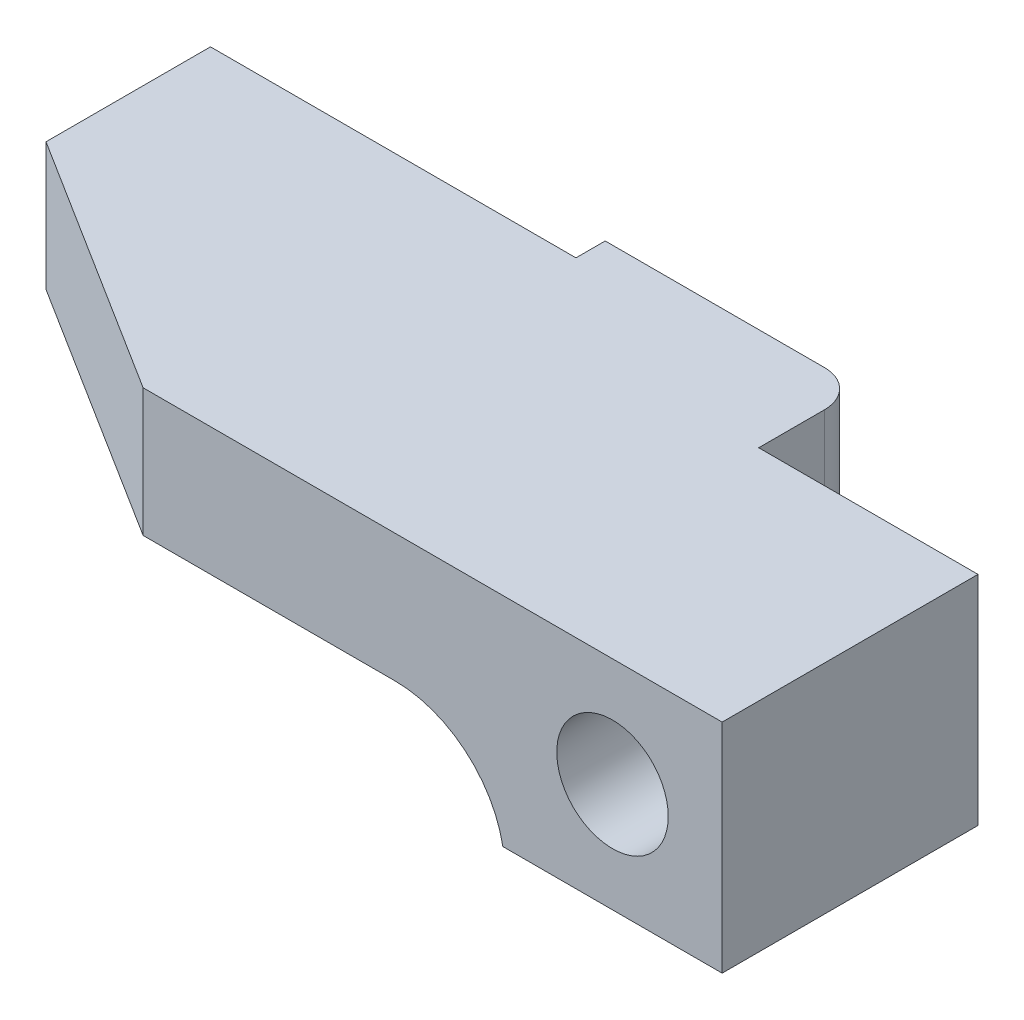
from build123d import *

# Parameters (mm, degrees)
EXTRUDE_1_DEPTH          = 3.5
EXTRUDE_2_DEPTH          = 3.5
EXTRUDE_2_DEPTH_BACK     = 2.45
SKETCH_3_W               = 6
SKETCH_3_H               = 9
CUT_EXTRUDE_1_DEPTH      = 26.244603384
CUT_EXTRUDE_1_DEPTH_BACK = 26.244603384
SKETCH_4_W               = 6
SKETCH_4_H               = 2
SKETCH_5_R               = 1.525
CUT_EXTRUDE_2_DEPTH      = 26.244603384
FILLET_2_R               = 1
FILLET_3_R               = 3


with BuildPart() as part:
    # 草图1 → 凸台-拉伸1 (new body)
    with BuildSketch(Plane(origin=(0, 0, 0), x_dir=(1, 0, 0), z_dir=(0, 1, 0))):
        Polygon((0, 0), (-6, 0), (-15.842640781, 0), (-23, 4.5), (-23, 9), (-13, 9), (-13, 9.8), (-6, 9.8), (-6, 9), (0, 9), align=None)
    extrude(amount=EXTRUDE_1_DEPTH)

    # 草图3 → 凸台-拉伸2 (add, two sides: drawn at the far end of the back side and taken through both)
    with BuildSketch(Plane(origin=(0, 0, 0), x_dir=(1, 0, 0), z_dir=(0, 1, 0)).offset(-EXTRUDE_2_DEPTH_BACK)):
        with Locations((-3, 4.5)):
            Rectangle(SKETCH_3_W, SKETCH_3_H)
    extrude(amount=EXTRUDE_2_DEPTH + EXTRUDE_2_DEPTH_BACK)

    # 草图4 → 切除-拉伸1 (cut, two sides: drawn at the far end of the back side and taken through both)
    with BuildSketch(Plane(origin=(0, 0, 0), x_dir=(1, 0, 0), z_dir=(0, 1, 0)).offset(-CUT_EXTRUDE_1_DEPTH_BACK)):
        with Locations((-3, 8)):
            Rectangle(SKETCH_4_W, SKETCH_4_H)
    extrude(amount=CUT_EXTRUDE_1_DEPTH + CUT_EXTRUDE_1_DEPTH_BACK, mode=Mode.SUBTRACT)

    # 草图5 → 切除-拉伸2 (cut, through all)
    with BuildSketch(Plane.XY):
        with Locations((-3, 0.525)):
            Circle(SKETCH_5_R)
    extrude(amount=-CUT_EXTRUDE_2_DEPTH, mode=Mode.SUBTRACT)

    # 圆角2
    fillet_2_edges = [part.edges().sort_by_distance(p)[0] for p in [
        (-6, 1.75, -9.8),
    ]]
    fillet(fillet_2_edges, radius=FILLET_2_R)

    # 圆角3
    # the kernel refuses this fillet: 3 mm, written as the material it adds along each edge
    with BuildSketch(Plane(origin=(-6, 0, -7), x_dir=(-1, 0, 0), z_dir=(0, 0, 1))) as fillet_3_piece_1:
        with BuildLine():
            CenterArc((2.949152421, 3), FILLET_3_R, 190.563977589, 79.436022411)
            Line((0, 2.45), (0, 0))
            Line((0, 0), (2.949152421, 0))
        make_face()
    extrude(amount=7)


solid = part.part
